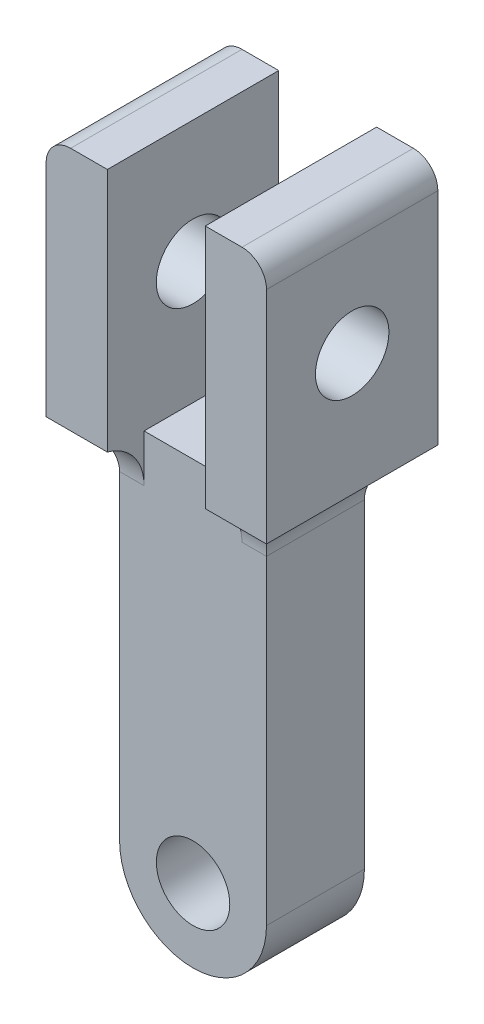
from build123d import *

# Parameters (mm, degrees)
SKETCH1_R           = 1.5
BOSS_EXTRUDE1_DEPTH = 4
SKETCH2_W           = 2.5
SKETCH2_H           = 7
BOSS_EXTRUDE2_DEPTH = 10
FILLET5_R           = 2
FILLET6_R           = 2
SKETCH3_R           = 1.5
CUT_EXTRUDE1_DEPTH  = 10
FILLET8_R           = 1


with BuildPart() as part:
    # Sketch1 → Boss-Extrude1 (new body)
    with BuildSketch(Plane.XY):
        with BuildLine():
            Line((-3, 0), (-3, 15))
            Line((-3, 15), (3, 15))
            Line((3, 15), (3, 0))
            ThreePointArc((3, 0), (0, -3), (-3, 0))
        make_face()
        Circle(SKETCH1_R, mode=Mode.SUBTRACT)
    extrude(amount=BOSS_EXTRUDE1_DEPTH)

    # Sketch2 → Boss-Extrude2 (add)
    with BuildSketch(Plane(origin=(0, 15, 0), x_dir=(1, 0, 0), z_dir=(0, 1, 0))):
        with Locations((3.25, -2)):
            Rectangle(SKETCH2_W, SKETCH2_H)
    boss_extrude2 = extrude(amount=BOSS_EXTRUDE2_DEPTH)

    # Mirror3: Boss-Extrude2 across plane
    add(boss_extrude2.mirror(Plane(origin=(0, 0, 0), x_dir=(0, 0, 1), z_dir=(1, 0, 0))))

    # Fillet5
    # the kernel refuses this fillet: 2 mm, written as the material it adds along each edge
    with BuildSketch(Plane(origin=(-3, 15, 4), x_dir=(0, 0, 1), z_dir=(1, 0, 0))) as fillet5_piece_1:
        with BuildLine():
            CenterArc((2, 1.936491673), FILLET5_R, 180, 75.522487814)
            Line((0, 1.936491673), (0, 0))
            Line((0, 0), (1.5, 0))
        make_face()
    extrude(amount=1)
    with BuildSketch(Plane(origin=(-3, 15, 0), x_dir=(0, 0, -1), z_dir=(1, 0, 0))) as fillet5_piece_2:
        with BuildLine():
            CenterArc((2, -1.936491673), FILLET5_R, 104.477512186, 75.522487814)
            Line((0, -1.936491673), (0, 0))
            Line((0, 0), (1.5, 0))
        make_face()
    extrude(amount=1)
    with BuildSketch(Plane(origin=(-3, 15, 0), x_dir=(0, -1, 0), z_dir=(0, 0, 1))) as fillet5_piece_3:
        with BuildLine():
            CenterArc((1.936491673, -2), FILLET5_R, 90, 75.522487814)
            Line((0, -1.5), (0, 0))
            Line((0, 0), (1.936491673, 0))
        make_face()
    extrude(amount=4)
    with BuildSketch(Plane(origin=(-3, 15, 0), x_dir=(0, -1, 0), z_dir=(0, 0, 1))) as fillet5_piece_4a_section:
        with BuildLine():
            CenterArc((1.936491673, -2), FILLET5_R, 90, 75.522487814)
            Line((0, -1.5), (0, 0))
            Line((0, 0), (1.936491673, 0))
        make_face()
    fillet5_piece_4a = extrude(amount=8.841229183, mode=Mode.PRIVATE)
    fillet5_piece_4a = split(fillet5_piece_4a, bisect_by=Plane(origin=(-3, 15, 4), z_dir=(0, 0, 1)), keep=Keep.TOP, mode=Mode.PRIVATE)
    fillet5_piece_4a = split(fillet5_piece_4a, bisect_by=Plane(origin=(-3, 15, 5.5), z_dir=(0, 0, -1)), keep=Keep.TOP, mode=Mode.PRIVATE)
    with BuildSketch(Plane(origin=(-7.841229183, 15, 4), x_dir=(0, 0, 1), z_dir=(1, 0, 0))) as fillet5_piece_4b_section:
        with BuildLine():
            CenterArc((2, 1.936491673), FILLET5_R, 180, 75.522487814)
            Line((0, 1.936491673), (0, 0))
            Line((0, 0), (1.5, 0))
        make_face()
    fillet5_piece_4b = extrude(amount=5.841229183, mode=Mode.PRIVATE)
    fillet5_piece_4b = split(fillet5_piece_4b, bisect_by=Plane(origin=(-3, 15, 4), z_dir=(-1, 0, 0)), keep=Keep.TOP, mode=Mode.PRIVATE)
    fillet5_piece_4b = split(fillet5_piece_4b, bisect_by=Plane(origin=(-4.5, 15, 4), z_dir=(1, 0, 0)), keep=Keep.TOP, mode=Mode.PRIVATE)
    fillet5_piece_4 = fillet5_piece_4a & fillet5_piece_4b
    add(fillet5_piece_4)
    with BuildSketch(Plane(origin=(-3, 15, -4.841229183), x_dir=(0, -1, 0), z_dir=(0, 0, 1))) as fillet5_piece_5a_section:
        with BuildLine():
            CenterArc((1.936491673, -2), FILLET5_R, 90, 75.522487814)
            Line((0, -1.5), (0, 0))
            Line((0, 0), (1.936491673, 0))
        make_face()
    fillet5_piece_5a = extrude(amount=8.841229183, mode=Mode.PRIVATE)
    fillet5_piece_5a = split(fillet5_piece_5a, bisect_by=Plane(origin=(-3, 15, 0), z_dir=(0, 0, -1)), keep=Keep.TOP, mode=Mode.PRIVATE)
    fillet5_piece_5a = split(fillet5_piece_5a, bisect_by=Plane(origin=(-3, 15, -1.5), z_dir=(0, 0, 1)), keep=Keep.TOP, mode=Mode.PRIVATE)
    with BuildSketch(Plane(origin=(-7.841229183, 15, 0), x_dir=(0, 0, -1), z_dir=(1, 0, 0))) as fillet5_piece_5b_section:
        with BuildLine():
            CenterArc((2, -1.936491673), FILLET5_R, 104.477512186, 75.522487814)
            Line((0, -1.936491673), (0, 0))
            Line((0, 0), (1.5, 0))
        make_face()
    fillet5_piece_5b = extrude(amount=5.841229183, mode=Mode.PRIVATE)
    fillet5_piece_5b = split(fillet5_piece_5b, bisect_by=Plane(origin=(-3, 15, 0), z_dir=(-1, 0, 0)), keep=Keep.TOP, mode=Mode.PRIVATE)
    fillet5_piece_5b = split(fillet5_piece_5b, bisect_by=Plane(origin=(-4.5, 15, 0), z_dir=(1, 0, 0)), keep=Keep.TOP, mode=Mode.PRIVATE)
    fillet5_piece_5 = fillet5_piece_5a & fillet5_piece_5b
    add(fillet5_piece_5)

    # Fillet6
    # the kernel refuses this fillet: 2 mm, written as the material it adds along each edge
    with BuildSketch(Plane(origin=(2, 15, 4), x_dir=(0, -1, 0), z_dir=(1, 0, 0))) as fillet6_piece_1:
        with BuildLine():
            CenterArc((1.936491673, -2), FILLET6_R, 90, 75.522487814)
            Line((0, -1.5), (0, 0))
            Line((0, 0), (1.936491673, 0))
        make_face()
    extrude(amount=1)
    with BuildSketch(Plane(origin=(2, 15, 0), x_dir=(0, 0, -1), z_dir=(1, 0, 0))) as fillet6_piece_2:
        with BuildLine():
            CenterArc((2, -1.936491673), FILLET6_R, 104.477512186, 75.522487814)
            Line((0, -1.936491673), (0, 0))
            Line((0, 0), (1.5, 0))
        make_face()
    extrude(amount=1)
    with BuildSketch(Plane(origin=(3, 15, 0), x_dir=(1, 0, 0), z_dir=(0, 0, 1))) as fillet6_piece_3:
        with BuildLine():
            CenterArc((2, -1.936491673), FILLET6_R, 104.477512186, 75.522487814)
            Line((0, -1.936491673), (0, 0))
            Line((0, 0), (1.5, 0))
        make_face()
    extrude(amount=4)
    with BuildSketch(Plane(origin=(2, 15, 4), x_dir=(0, -1, 0), z_dir=(1, 0, 0))) as fillet6_piece_4a_section:
        with BuildLine():
            CenterArc((1.936491673, -2), FILLET6_R, 90, 75.522487814)
            Line((0, -1.5), (0, 0))
            Line((0, 0), (1.936491673, 0))
        make_face()
    fillet6_piece_4a = extrude(amount=5.841229183, mode=Mode.PRIVATE)
    fillet6_piece_4a = split(fillet6_piece_4a, bisect_by=Plane(origin=(4.5, 15, 4), z_dir=(-1, 0, 0)), keep=Keep.TOP, mode=Mode.PRIVATE)
    fillet6_piece_4a = split(fillet6_piece_4a, bisect_by=Plane(origin=(3, 15, 4), z_dir=(1, 0, 0)), keep=Keep.TOP, mode=Mode.PRIVATE)
    with BuildSketch(Plane(origin=(3, 15, 0), x_dir=(1, 0, 0), z_dir=(0, 0, 1))) as fillet6_piece_4b_section:
        with BuildLine():
            CenterArc((2, -1.936491673), FILLET6_R, 104.477512186, 75.522487814)
            Line((0, -1.936491673), (0, 0))
            Line((0, 0), (1.5, 0))
        make_face()
    fillet6_piece_4b = extrude(amount=8.841229183, mode=Mode.PRIVATE)
    fillet6_piece_4b = split(fillet6_piece_4b, bisect_by=Plane(origin=(3, 15, 4), z_dir=(0, 0, 1)), keep=Keep.TOP, mode=Mode.PRIVATE)
    fillet6_piece_4b = split(fillet6_piece_4b, bisect_by=Plane(origin=(3, 15, 5.5), z_dir=(0, 0, -1)), keep=Keep.TOP, mode=Mode.PRIVATE)
    fillet6_piece_4 = fillet6_piece_4a & fillet6_piece_4b
    add(fillet6_piece_4)
    with BuildSketch(Plane(origin=(2, 15, 0), x_dir=(0, 0, -1), z_dir=(1, 0, 0))) as fillet6_piece_5a_section:
        with BuildLine():
            CenterArc((2, -1.936491673), FILLET6_R, 104.477512186, 75.522487814)
            Line((0, -1.936491673), (0, 0))
            Line((0, 0), (1.5, 0))
        make_face()
    fillet6_piece_5a = extrude(amount=5.841229183, mode=Mode.PRIVATE)
    fillet6_piece_5a = split(fillet6_piece_5a, bisect_by=Plane(origin=(4.5, 15, 0), z_dir=(-1, 0, 0)), keep=Keep.TOP, mode=Mode.PRIVATE)
    fillet6_piece_5a = split(fillet6_piece_5a, bisect_by=Plane(origin=(3, 15, 0), z_dir=(1, 0, 0)), keep=Keep.TOP, mode=Mode.PRIVATE)
    with BuildSketch(Plane(origin=(3, 15, -4.841229183), x_dir=(1, 0, 0), z_dir=(0, 0, 1))) as fillet6_piece_5b_section:
        with BuildLine():
            CenterArc((2, -1.936491673), FILLET6_R, 104.477512186, 75.522487814)
            Line((0, -1.936491673), (0, 0))
            Line((0, 0), (1.5, 0))
        make_face()
    fillet6_piece_5b = extrude(amount=8.841229183, mode=Mode.PRIVATE)
    fillet6_piece_5b = split(fillet6_piece_5b, bisect_by=Plane(origin=(3, 15, -1.5), z_dir=(0, 0, 1)), keep=Keep.TOP, mode=Mode.PRIVATE)
    fillet6_piece_5b = split(fillet6_piece_5b, bisect_by=Plane(origin=(3, 15, 0), z_dir=(0, 0, -1)), keep=Keep.TOP, mode=Mode.PRIVATE)
    fillet6_piece_5 = fillet6_piece_5a & fillet6_piece_5b
    add(fillet6_piece_5)

    # Sketch3 → Cut-Extrude1 (cut)
    with BuildSketch(Plane.ZY.offset(4.5)):
        with Locations((2, 20)):
            Circle(SKETCH3_R)
    extrude(amount=-CUT_EXTRUDE1_DEPTH, mode=Mode.SUBTRACT)

    # Fillet8
    fillet8_edges = [part.edges().sort_by_distance(p)[0] for p in [
        (4.5, 25, 2),
        (-4.5, 25, 2),
    ]]
    fillet(fillet8_edges, radius=FILLET8_R)


solid = part.part
